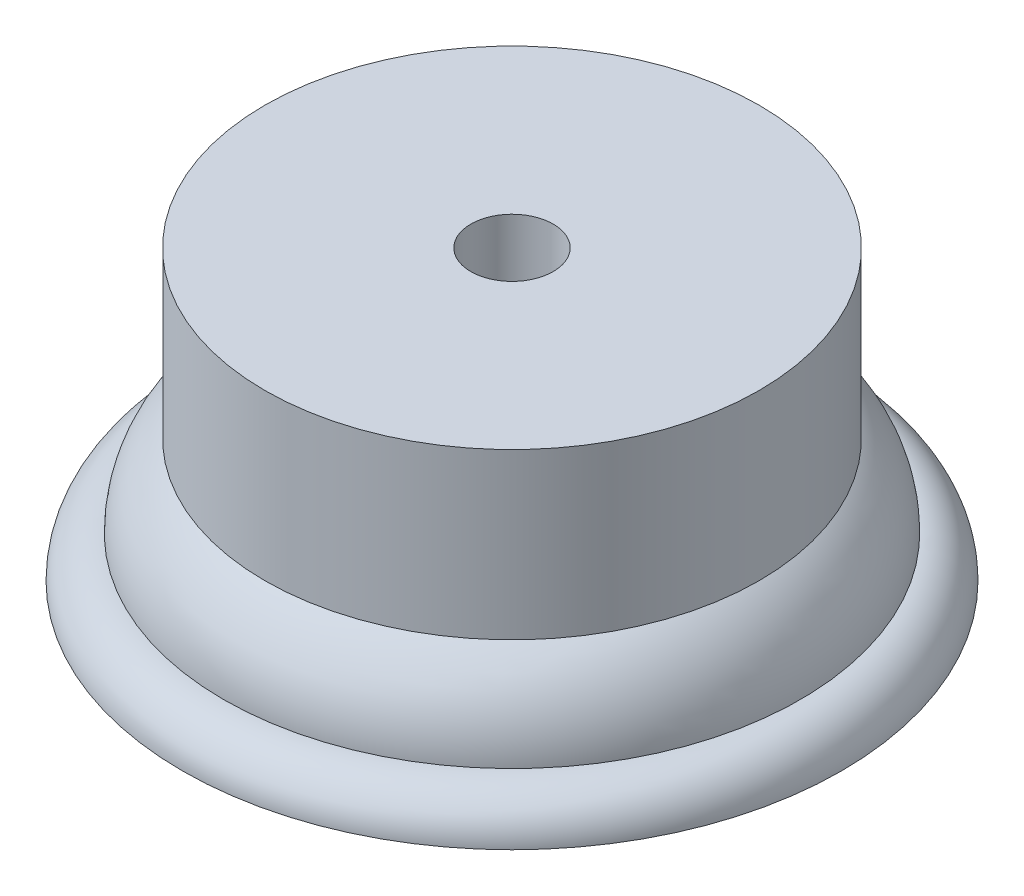
from build123d import *

# Parameters (mm, degrees)
SKETCH1_R                         = 8
BLADE_HOLDER_EXTRUDE_DEPTH        = 1
SKETCH2_R                         = 7
BLADE_HOLDER_EXTRUDE_2_DEPTH      = 2
SKETCH3_R                         = 6
BLADE_HOLDER_EXTRUDE_3_DEPTH      = 4
SKETCH4_R                         = 1
HOLE_FOR_SCREW_BLADE_HOLDER_DEPTH = 24
BLADE_HOLDER_FILLET_1_R           = 1
BLADE_HOLDER_FILLET_2_R           = 2.5


# Some blends are built 0.0001 mm under size
with BuildPart() as part:
    # Sketch1 → Blade Holder Extrude (new body)
    with BuildSketch(Plane(origin=(0, 0, 0), x_dir=(1, 0, 0), z_dir=(0, 1, 0))):
        with Locations(Location((0, 0, 0), (0, 0, 270))):
            Circle(SKETCH1_R)
    extrude(amount=BLADE_HOLDER_EXTRUDE_DEPTH)

    # Sketch2 → Blade Holder Extrude 2 (add)
    with BuildSketch(Plane(origin=(0, 1, 0), x_dir=(1, 0, 0), z_dir=(0, 1, 0))):
        with Locations(Location((0, 0, 0), (0, 0, 270))):
            Circle(SKETCH2_R)
    extrude(amount=BLADE_HOLDER_EXTRUDE_2_DEPTH)

    # Sketch3 → Blade Holder Extrude 3 (add)
    with BuildSketch(Plane(origin=(0, 3, 0), x_dir=(1, 0, 0), z_dir=(0, 1, 0))):
        with Locations(Location((0, 0, 0), (0, 0, 270))):
            Circle(SKETCH3_R)
    extrude(amount=BLADE_HOLDER_EXTRUDE_3_DEPTH)

    # Sketch4 → Hole for Screw (Blade Holder) (cut)
    with BuildSketch(Plane(origin=(0, 7, 0), x_dir=(1, 0, 0), z_dir=(0, 1, 0))):
        with Locations(Location((0, 0, 0), (0, 0, 270))):
            Circle(SKETCH4_R)
    extrude(amount=-HOLE_FOR_SCREW_BLADE_HOLDER_DEPTH, mode=Mode.SUBTRACT)

    # Blade Holder Fillet 1
    blade_holder_fillet_1_edges = [part.edges().sort_by_distance(p)[0] for p in [
        (0, 1, -8),
    ]]
    fillet(blade_holder_fillet_1_edges, radius=BLADE_HOLDER_FILLET_1_R - 0.0001)  # a hair under: the kernel refuses the full size

    # Blade Holder Fillet 2
    # the kernel refuses this fillet: 2.5 mm, written as the material it takes off along each edge
    with BuildSketch(Plane(origin=(0, 3, 0), x_dir=(0, 0, 1), z_dir=(-1, 0, 0))) as blade_holder_fillet_2_piece_1:
        with BuildLine():
            CenterArc((4.5, -2), BLADE_HOLDER_FILLET_2_R, 0, 53.130102354)
            Line((6, 0), (7, 0))
            Line((7, 0), (7, -2))
        make_face()
    revolve(axis=Axis((0, 3, 0), (0, 1, 0)), mode=Mode.SUBTRACT)


solid = part.part
